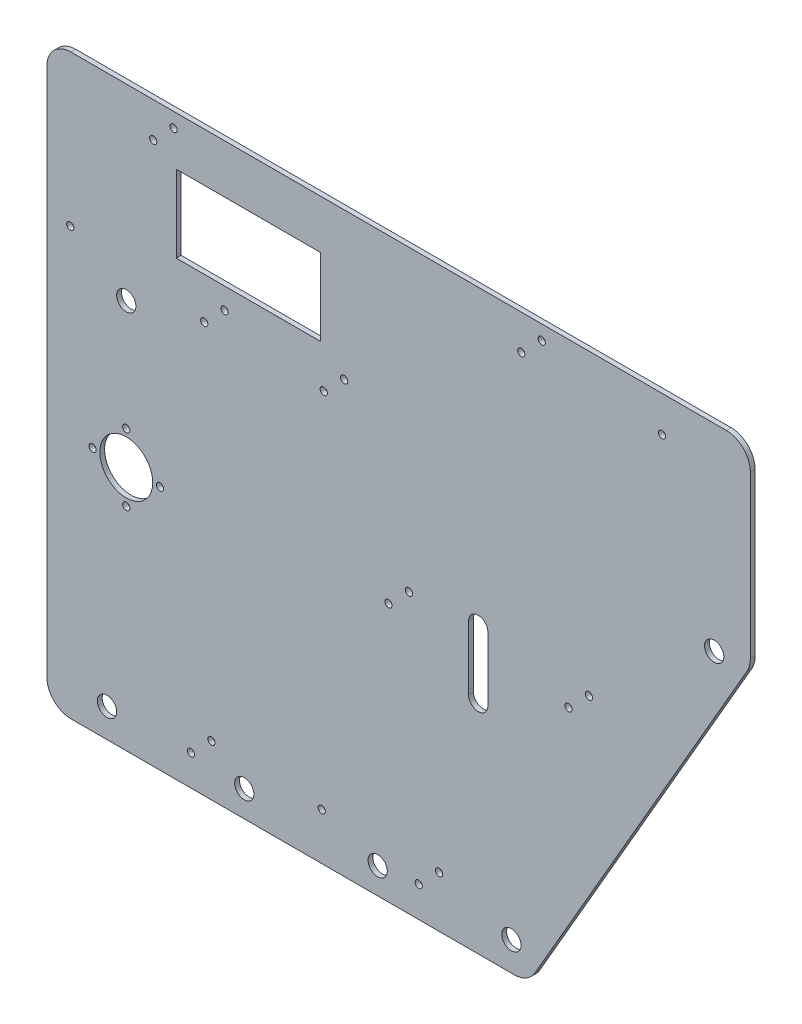
from build123d import *

# Parameters (mm, degrees)
BOSS_EXTRUDE1_DEPTH = 2
SKETCH2_R           = 4
SKETCH2_R_2         = 11
SKETCH2_R_3         = 1.5
CUT_EXTRUDE1_DEPTH  = 3
SKETCH4_W           = 292.37604307
SKETCH4_H           = 50
BOSS_EXTRUDE2_DEPTH = 2
FILLET1_R           = 10
SKETCH5_R           = 1.5
SKETCH5_W           = 60
SKETCH5_H           = 32
CUT_EXTRUDE2_DEPTH  = 11


with BuildPart() as part:
    # Sketch1 → Boss-Extrude1 (new body)
    with BuildSketch(Plane.XY):
        Polygon((-100, 110), (-100, -80), (100, -80), (192.37604307, 80), (192.37604307, 110), align=None)
    extrude(amount=BOSS_EXTRUDE1_DEPTH)

    # Sketch2 → Cut-Extrude1 (cut)
    with BuildSketch(Plane.XY.offset(2)):
        with Locations((93.07179677, -68)):
            Circle(SKETCH2_R)
        with Locations((177.364936071, 78)):
            Circle(SKETCH2_R)
        with Locations((-67, 22)):
            Circle(SKETCH2_R_2)
        with Locations((-75, -68)):
            Circle(SKETCH2_R)
        with Locations((-53, 22)):
            Circle(SKETCH2_R_3)
        with Locations((-67, 36)):
            Circle(SKETCH2_R_3)
        with Locations((-81, 22)):
            Circle(SKETCH2_R_3)
        with Locations((-67, 8)):
            Circle(SKETCH2_R_3)
        with Locations((54.54952947, -67.242640687)):
            Circle(SKETCH2_R_3)
        with Locations((63.034810844, -58.757359313)):
            Circle(SKETCH2_R_3)
        with Locations((14.225855729, -60.5)):
            Circle(SKETCH2_R_3)
        with Locations((-40.127135228, -67.242640687)):
            Circle(SKETCH2_R_3)
        with Locations((-31.641853854, -58.757359313)):
            Circle(SKETCH2_R_3)
        with Locations((-90.295627115, 97.216930167)):
            Circle(SKETCH2_R_3)
        with Locations((-34.605070088, 90.47428948)):
            Circle(SKETCH2_R_3)
        with Locations((-26.119788714, 98.959570854)):
            Circle(SKETCH2_R_3)
        with Locations((15.078196993, 90.47428948)):
            Circle(SKETCH2_R_3)
        with Locations((23.563478368, 98.959570854)):
            Circle(SKETCH2_R_3)
        with Locations((41.969500075, 27.47428948)):
            Circle(SKETCH2_R_3)
        with Locations((50.454781449, 35.959570854)):
            Circle(SKETCH2_R_3)
        with Locations((116.811272287, 27.47428948)):
            Circle(SKETCH2_R_3)
        with Locations((125.296553661, 35.959570854)):
            Circle(SKETCH2_R_3)
        with Locations((155.651799279, 145.145615666)):
            Circle(SKETCH2_R_3)
        with Locations((-55.814717647, 145.47428948)):
            Circle(SKETCH2_R_3)
        with Locations((-47.329436273, 153.959570854)):
            Circle(SKETCH2_R_3)
        with Locations((97.192431756, 145.47428948)):
            Circle(SKETCH2_R_3)
        with Locations((105.67771313, 153.959570854)):
            Circle(SKETCH2_R_3)
        with Locations((-17.947932492, -69.117445741)):
            Circle(SKETCH2_R)
        with Locations((37.494421294, -69.117445741)):
            Circle(SKETCH2_R)
        with Locations((-67, 82)):
            Circle(SKETCH2_R)
        with BuildLine():
            Line((75.290389443, 11.241781095), (75.290389443, 37.908558601))
            ThreePointArc((75.290389443, 37.908558601), (79.290389443, 41.908558601), (83.290389443, 37.908558601))
            Line((83.290389443, 37.908558601), (83.290389443, 11.241781095))
            ThreePointArc((83.290389443, 11.241781095), (79.290389443, 7.241781095), (75.290389443, 11.241781095))
        make_face()
    extrude(amount=-CUT_EXTRUDE1_DEPTH, mode=Mode.SUBTRACT)

    # Sketch4 → Boss-Extrude2 (add)
    with BuildSketch(Plane.XY.offset(2)):
        with Locations((46.188021535, 135)):
            Rectangle(SKETCH4_W, SKETCH4_H)
    extrude(amount=-BOSS_EXTRUDE2_DEPTH)

    # Fillet1
    fillet1_edges = [part.edges().sort_by_distance(p)[0] for p in [
        (192.37604307, 160, 1),
        (192.37604307, 80, 1),
        (100, -80, 1),
        (-100, -80, 1),
        (-100, 160, 1),
    ]]
    fillet(fillet1_edges, radius=FILLET1_R)

    # Sketch5 → Cut-Extrude2 (cut)
    with BuildSketch(Plane.XY.offset(2)):
        with Locations((-55.814717647, 145.47428948)):
            Circle(SKETCH5_R)
        with Locations((-47.329436273, 153.959570854)):
            Circle(SKETCH5_R)
        with Locations((97.192431756, 145.47428948)):
            Circle(SKETCH5_R)
        with Locations((105.67771313, 153.959570854)):
            Circle(SKETCH5_R)
        with Locations((155.651799279, 145.145615666)):
            Circle(SKETCH5_R)
        with Locations((-16.178132997, 123.716930167)):
            Rectangle(SKETCH5_W, SKETCH5_H)
    extrude(amount=-CUT_EXTRUDE2_DEPTH, mode=Mode.SUBTRACT)


solid = part.part
